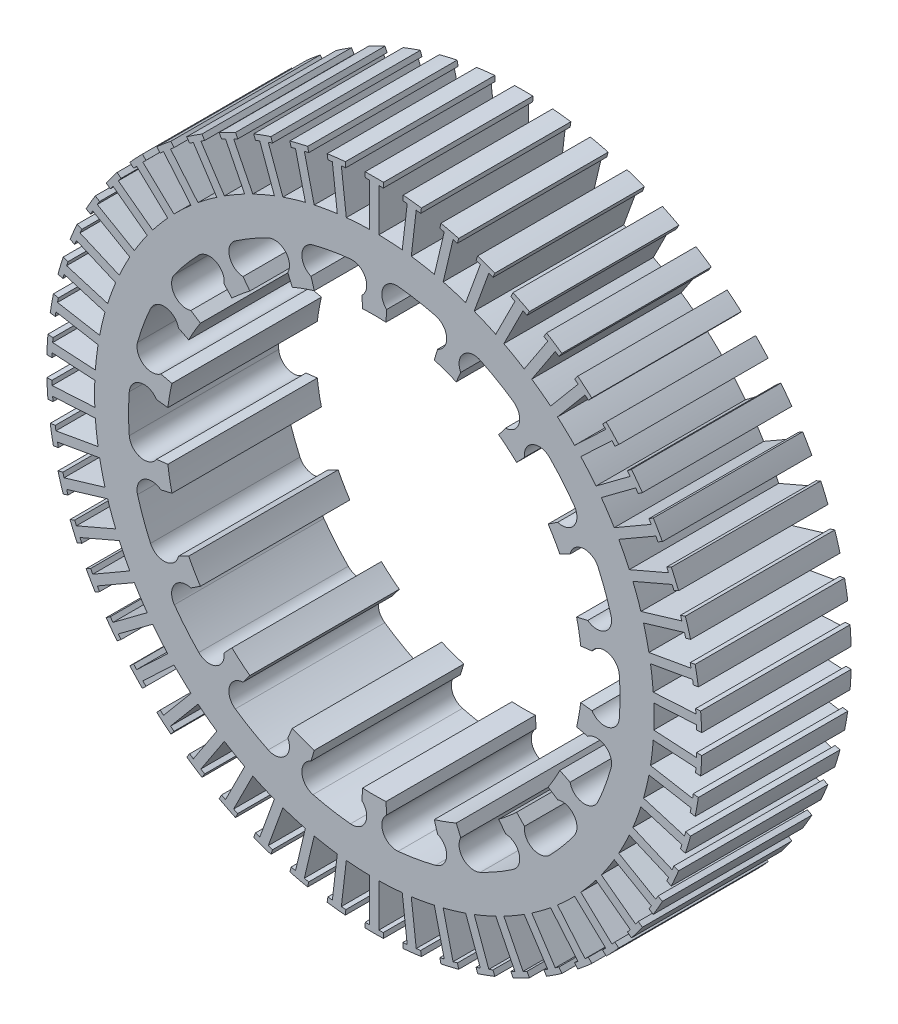
from build123d import *

# Parameters (mm, degrees)
SKETCH1_R           = 36.966779
BOSS_EXTRUDE1_DEPTH = 19.750024
SKETCH2_R           = 32.478218
BOSS_EXTRUDE2_DEPTH = 19.750024


with BuildPart() as part:
    # Sketch1 → Boss-Extrude1 (new body)
    with BuildSketch(Plane.XY):
        Circle(SKETCH1_R)
        with BuildLine():
            Line((1.546352, -27.427050505), (1.631124552, -28.930628639))
            ThreePointArc((1.631124552, -28.930628639), (1.168844503, -31.173997989), (3.149035062, -32.325194858))
            ThreePointArc((3.149035062, -32.325194858), (4.397703875, -32.179105722), (5.63978337, -31.98480089))
            ThreePointArc((5.63978337, -31.98480089), (6.873412472, -31.7425715), (8.096742768, -31.452780497))
            ThreePointArc((8.096742768, -31.452780497), (9.563780706, -29.693744235), (8.362102049, -27.7437757))
            Line((8.362102049, -27.7437757), (7.927508181, -26.301880502))
            ThreePointArc((7.927508181, -26.301880502), (9.395501285, -25.813927626), (10.833699308, -25.244113436))
            Line((10.833699308, -25.244113436), (11.427613459, -26.628020794))
            ThreePointArc((11.427613459, -26.628020794), (11.760489815, -28.894207506), (14.014992789, -29.29871365))
            ThreePointArc((14.014992789, -29.29871365), (15.138392231, -28.734364881), (16.239109, -28.126961858))
            ThreePointArc((16.239109, -28.126961858), (17.315493833, -27.477414685), (18.365933925, -26.786696615))
            ThreePointArc((18.365933925, -26.786696615), (19.142872815, -24.631986694), (17.346735731, -23.210613957))
            Line((17.346735731, -23.210613957), (16.445193878, -22.004315536))
            ThreePointArc((16.445193878, -22.004315536), (17.657766453, -21.043706607), (18.814342591, -20.016363724))
            Line((18.814342591, -20.016363724), (19.845763529, -21.113680654))
            ThreePointArc((19.845763529, -21.113680654), (20.933646488, -23.129349165), (23.190535546, -22.738375173))
            ThreePointArc((23.190535546, -22.738375173), (24.053167065, -21.823835561), (24.879758421, -20.876596115))
            ThreePointArc((24.879758421, -20.876596115), (25.669071089, -19.898076135), (26.419922398, -18.889741791))
            ThreePointArc((26.419922398, -18.889741791), (26.413051944, -16.599248028), (24.239097073, -15.877909618))
            Line((24.239097073, -15.877909618), (22.979346488, -15.052705367))
            ThreePointArc((22.979346488, -15.052705367), (23.790244385, -13.735304), (24.525698488, -12.374345137))
            Line((24.525698488, -12.374345137), (25.870221625, -13.052719021))
            ThreePointArc((25.870221625, -13.052719021), (27.581896448, -14.574749961), (29.568957461, -13.435453068))
            ThreePointArc((29.568957461, -13.435453068), (30.066774964, -12.281029587), (30.519541791, -11.108204775))
            ThreePointArc((30.519541791, -11.108204775), (30.926579536, -9.918735939), (31.287278314, -8.714405324))
            ThreePointArc((31.287278314, -8.714405324), (30.497427194, -6.56439507), (28.207865578, -6.630095047))
            Line((28.207865578, -6.630095047), (26.741850772, -6.285516777))
            ThreePointArc((26.741850772, -6.285516777), (27.053267738, -4.770221019), (27.278893186, -3.2397979))
            Line((27.278893186, -3.2397979), (28.77434919, -3.417406837))
            ThreePointArc((28.77434919, -3.417406837), (30.90336263, -4.262220812), (32.380926714, -2.512017036))
            ThreePointArc((32.380926714, -2.512017036), (32.453886064, -1.256950196), (32.478218, 0))
            ThreePointArc((32.478218, 0), (32.453886064, 1.256950196), (32.380926714, 2.512017036))
            ThreePointArc((32.380926714, 2.512017036), (30.90336263, 4.262220812), (28.77434919, 3.417406837))
            Line((28.77434919, 3.417406837), (27.278893186, 3.2397979))
            ThreePointArc((27.278893186, 3.2397979), (27.053267738, 4.770221019), (26.741850772, 6.285516777))
            Line((26.741850772, 6.285516777), (28.207865578, 6.630095047))
            ThreePointArc((28.207865578, 6.630095047), (30.497427194, 6.56439507), (31.287278314, 8.714405324))
            ThreePointArc((31.287278314, 8.714405324), (30.926579536, 9.918735939), (30.519541791, 11.108204775))
            ThreePointArc((30.519541791, 11.108204775), (30.066774964, 12.281029587), (29.568957461, 13.435453068))
            ThreePointArc((29.568957461, 13.435453068), (27.581896448, 14.574749961), (25.870221625, 13.052719021))
            Line((25.870221625, 13.052719021), (24.525698488, 12.374345137))
            ThreePointArc((24.525698488, 12.374345137), (23.790244385, 13.735304), (22.979346488, 15.052705367))
            Line((22.979346488, 15.052705367), (24.239097073, 15.877909618))
            ThreePointArc((24.239097073, 15.877909618), (26.413051944, 16.599248028), (26.419922398, 18.889741791))
            ThreePointArc((26.419922398, 18.889741791), (25.669071089, 19.898076135), (24.879758421, 20.876596115))
            ThreePointArc((24.879758421, 20.876596115), (24.053167065, 21.823835561), (23.190535546, 22.738375173))
            ThreePointArc((23.190535546, 22.738375173), (20.933646488, 23.129349165), (19.845763529, 21.113680654))
            Line((19.845763529, 21.113680654), (18.814342591, 20.016363724))
            ThreePointArc((18.814342591, 20.016363724), (17.657766453, 21.043706607), (16.445193878, 22.004315536))
            Line((16.445193878, 22.004315536), (17.346735731, 23.210613957))
            ThreePointArc((17.346735731, 23.210613957), (19.142872815, 24.631986694), (18.365933925, 26.786696615))
            ThreePointArc((18.365933925, 26.786696615), (17.315493833, 27.477414685), (16.239109, 28.126961858))
            ThreePointArc((16.239109, 28.126961858), (15.138392231, 28.734364881), (14.014992789, 29.29871365))
            ThreePointArc((14.014992789, 29.29871365), (11.760489815, 28.894207506), (11.427613459, 26.628020794))
            Line((11.427613459, 26.628020794), (10.833699308, 25.244113436))
            ThreePointArc((10.833699308, 25.244113436), (9.395501285, 25.813927626), (7.927508181, 26.301880502))
            Line((7.927508181, 26.301880502), (8.362102049, 27.7437757))
            ThreePointArc((8.362102049, 27.7437757), (9.563780706, 29.693744235), (8.096742768, 31.452780497))
            ThreePointArc((8.096742768, 31.452780497), (6.873412472, 31.7425715), (5.63978337, 31.98480089))
            ThreePointArc((5.63978337, 31.98480089), (4.397703875, 32.179105722), (3.149035062, 32.325194858))
            ThreePointArc((3.149035062, 32.325194858), (1.168844503, 31.173997989), (1.631124552, 28.930628639))
            Line((1.631124552, 28.930628639), (1.546352, 27.427050505))
            ThreePointArc((1.546352, 27.427050505), (0, 27.470608), (-1.546352, 27.427050505))
            Line((-1.546352, 27.427050505), (-1.631124552, 28.930628639))
            ThreePointArc((-1.631124552, 28.930628639), (-1.168844503, 31.173997989), (-3.149035062, 32.325194858))
            ThreePointArc((-3.149035062, 32.325194858), (-4.397703875, 32.179105722), (-5.63978337, 31.98480089))
            ThreePointArc((-5.63978337, 31.98480089), (-6.873412472, 31.7425715), (-8.096742768, 31.452780497))
            ThreePointArc((-8.096742768, 31.452780497), (-9.563780706, 29.693744235), (-8.362102049, 27.7437757))
            Line((-8.362102049, 27.7437757), (-7.927508181, 26.301880502))
            ThreePointArc((-7.927508181, 26.301880502), (-9.395501285, 25.813927626), (-10.833699308, 25.244113436))
            Line((-10.833699308, 25.244113436), (-11.427613459, 26.628020794))
            ThreePointArc((-11.427613459, 26.628020794), (-11.760489815, 28.894207506), (-14.014992789, 29.29871365))
            ThreePointArc((-14.014992789, 29.29871365), (-15.138392231, 28.734364881), (-16.239109, 28.126961858))
            ThreePointArc((-16.239109, 28.126961858), (-17.315493833, 27.477414685), (-18.365933925, 26.786696615))
            ThreePointArc((-18.365933925, 26.786696615), (-19.142872815, 24.631986694), (-17.346735731, 23.210613957))
            Line((-17.346735731, 23.210613957), (-16.445193878, 22.004315536))
            ThreePointArc((-16.445193878, 22.004315536), (-17.657766453, 21.043706607), (-18.814342591, 20.016363724))
            Line((-18.814342591, 20.016363724), (-19.845763529, 21.113680654))
            ThreePointArc((-19.845763529, 21.113680654), (-20.933646488, 23.129349165), (-23.190535546, 22.738375173))
            ThreePointArc((-23.190535546, 22.738375173), (-24.053167065, 21.823835561), (-24.879758421, 20.876596115))
            ThreePointArc((-24.879758421, 20.876596115), (-25.669071089, 19.898076135), (-26.419922398, 18.889741791))
            ThreePointArc((-26.419922398, 18.889741791), (-26.413051944, 16.599248028), (-24.239097073, 15.877909618))
            Line((-24.239097073, 15.877909618), (-22.979346488, 15.052705367))
            ThreePointArc((-22.979346488, 15.052705367), (-23.790244385, 13.735304), (-24.525698488, 12.374345137))
            Line((-24.525698488, 12.374345137), (-25.870221625, 13.052719021))
            ThreePointArc((-25.870221625, 13.052719021), (-27.581896448, 14.574749961), (-29.568957461, 13.435453068))
            ThreePointArc((-29.568957461, 13.435453068), (-30.066774964, 12.281029587), (-30.519541791, 11.108204775))
            ThreePointArc((-30.519541791, 11.108204775), (-30.926579536, 9.918735939), (-31.287278314, 8.714405324))
            ThreePointArc((-31.287278314, 8.714405324), (-30.497427194, 6.56439507), (-28.207865578, 6.630095047))
            Line((-28.207865578, 6.630095047), (-26.741850772, 6.285516777))
            ThreePointArc((-26.741850772, 6.285516777), (-27.053267738, 4.770221019), (-27.278893186, 3.2397979))
            Line((-27.278893186, 3.2397979), (-28.77434919, 3.417406837))
            ThreePointArc((-28.77434919, 3.417406837), (-30.90336263, 4.262220812), (-32.380926714, 2.512017036))
            ThreePointArc((-32.380926714, 2.512017036), (-32.453886064, 1.256950196), (-32.478218, 0))
            ThreePointArc((-32.478218, 0), (-32.453886064, -1.256950196), (-32.380926714, -2.512017036))
            ThreePointArc((-32.380926714, -2.512017036), (-30.90336263, -4.262220812), (-28.77434919, -3.417406837))
            Line((-28.77434919, -3.417406837), (-27.278893186, -3.2397979))
            ThreePointArc((-27.278893186, -3.2397979), (-27.053267738, -4.770221019), (-26.741850772, -6.285516777))
            Line((-26.741850772, -6.285516777), (-28.207865578, -6.630095047))
            ThreePointArc((-28.207865578, -6.630095047), (-30.497427194, -6.56439507), (-31.287278314, -8.714405324))
            ThreePointArc((-31.287278314, -8.714405324), (-30.926579536, -9.918735939), (-30.519541791, -11.108204775))
            ThreePointArc((-30.519541791, -11.108204775), (-30.066774964, -12.281029587), (-29.568957461, -13.435453068))
            ThreePointArc((-29.568957461, -13.435453068), (-27.581896448, -14.574749961), (-25.870221625, -13.052719021))
            Line((-25.870221625, -13.052719021), (-24.525698488, -12.374345137))
            ThreePointArc((-24.525698488, -12.374345137), (-23.790244385, -13.735304), (-22.979346488, -15.052705367))
            Line((-22.979346488, -15.052705367), (-24.239097073, -15.877909618))
            ThreePointArc((-24.239097073, -15.877909618), (-26.413051944, -16.599248028), (-26.419922398, -18.889741791))
            ThreePointArc((-26.419922398, -18.889741791), (-25.669071089, -19.898076135), (-24.879758421, -20.876596115))
            ThreePointArc((-24.879758421, -20.876596115), (-24.053167065, -21.823835561), (-23.190535546, -22.738375173))
            ThreePointArc((-23.190535546, -22.738375173), (-20.933646488, -23.129349165), (-19.845763529, -21.113680654))
            Line((-19.845763529, -21.113680654), (-18.814342591, -20.016363724))
            ThreePointArc((-18.814342591, -20.016363724), (-17.657766453, -21.043706607), (-16.445193878, -22.004315536))
            Line((-16.445193878, -22.004315536), (-17.346735731, -23.210613957))
            ThreePointArc((-17.346735731, -23.210613957), (-19.142872815, -24.631986694), (-18.365933925, -26.786696615))
            ThreePointArc((-18.365933925, -26.786696615), (-17.315493833, -27.477414685), (-16.239109, -28.126961858))
            ThreePointArc((-16.239109, -28.126961858), (-15.138392231, -28.734364881), (-14.014992789, -29.29871365))
            ThreePointArc((-14.014992789, -29.29871365), (-11.760489815, -28.894207506), (-11.427613459, -26.628020794))
            Line((-11.427613459, -26.628020794), (-10.833699308, -25.244113436))
            ThreePointArc((-10.833699308, -25.244113436), (-9.395501285, -25.813927626), (-7.927508181, -26.301880502))
            Line((-7.927508181, -26.301880502), (-8.362102049, -27.7437757))
            ThreePointArc((-8.362102049, -27.7437757), (-9.563780706, -29.693744235), (-8.096742768, -31.452780497))
            ThreePointArc((-8.096742768, -31.452780497), (-6.873412472, -31.7425715), (-5.63978337, -31.98480089))
            ThreePointArc((-5.63978337, -31.98480089), (-4.397703875, -32.179105722), (-3.149035062, -32.325194858))
            ThreePointArc((-3.149035062, -32.325194858), (-1.168844503, -31.173997989), (-1.631124552, -28.930628639))
            Line((-1.631124552, -28.930628639), (-1.546352, -27.427050505))
            ThreePointArc((-1.546352, -27.427050505), (0, -27.470608), (1.546352, -27.427050505))
        make_face(mode=Mode.SUBTRACT)
    extrude(amount=-BOSS_EXTRUDE1_DEPTH)

    # Sketch2 → Boss-Extrude2 (add)
    with BuildSketch(Plane.XY):
        with BuildLine():
            Line((0.599948, -36.961910287), (0.599948, -42.615834159))
            ThreePointArc((0.599948, -42.615834159), (0.89532901, -42.610651774), (1.190667002, -42.603422055))
            Line((1.190667002, -42.603422055), (1.209378998, -43.272958627))
            ThreePointArc((1.209378998, -43.272958627), (0, -43.289855), (-1.209378998, -43.272958627))
            Line((-1.209378998, -43.272958627), (-1.190667002, -42.603422055))
            ThreePointArc((-1.190667002, -42.603422055), (-0.89532901, -42.610651774), (-0.599948, -42.615834159))
            Line((-0.599948, -42.615834159), (-0.599948, -36.961910287))
            ThreePointArc((-0.599948, -36.961910287), (-2.14942704, -36.904237061), (-3.695124511, -36.781636784))
            Line((-3.695124511, -36.781636784), (-4.351505009, -42.397330846))
            ThreePointArc((-4.351505009, -42.397330846), (-4.057519622, -42.426475145), (-3.763339281, -42.453580958))
            Line((-3.763339281, -42.453580958), (-3.82248226, -43.120762694))
            ThreePointArc((-3.82248226, -43.120762694), (-5.025645419, -42.997144487), (-6.22488548, -42.839962029))
            Line((-6.22488548, -42.839962029), (-6.128571555, -42.177124954))
            ThreePointArc((-6.128571555, -42.177124954), (-5.836069853, -42.218592437), (-5.543287742, -42.258031422))
            Line((-5.543287742, -42.258031422), (-4.886907243, -36.64233736))
            ThreePointArc((-4.886907243, -36.64233736), (-6.419213808, -36.405170563), (-7.940226801, -36.103954742))
            Line((-7.940226801, -36.103954742), (-9.244111378, -41.605476364))
            ThreePointArc((-9.244111378, -41.605476364), (-8.955497261, -41.66855322), (-8.666452855, -41.729628007))
            Line((-8.666452855, -41.729628007), (-8.802651002, -42.385432418))
            ThreePointArc((-8.802651002, -42.385432418), (-9.983327605, -42.122971356), (-11.156211064, -41.827628436))
            Line((-11.156211064, -41.827628436), (-10.983597692, -41.180454592))
            ThreePointArc((-10.983597692, -41.180454592), (-10.697887862, -41.255599062), (-10.411664026, -41.328761304))
            Line((-10.411664026, -41.328761304), (-9.107779449, -35.827239681))
            ThreePointArc((-9.107779449, -35.827239681), (-10.60219172, -35.413786586), (-12.077951145, -34.938028647))
            Line((-12.077951145, -34.938028647), (-14.011706999, -40.250979189))
            ThreePointArc((-14.011706999, -40.250979189), (-13.732367163, -40.347135596), (-13.452367522, -40.441353424))
            Line((-13.452367522, -40.441353424), (-13.663778991, -41.07691188))
            ThreePointArc((-13.663778991, -41.07691188), (-14.806002412, -40.679157298), (-15.936668032, -40.249647923))
            Line((-15.936668032, -40.249647923), (-15.690089512, -39.626889227))
            ThreePointArc((-15.690089512, -39.626889227), (-15.415035291, -39.734694483), (-15.139240416, -39.840590587))
            Line((-15.139240416, -39.840590587), (-13.205484562, -34.527640045))
            ThreePointArc((-13.205484562, -34.527640045), (-14.641793178, -33.943491897), (-16.05234192, -33.299625651))
            Line((-16.05234192, -33.299625651), (-18.589818319, -38.35215657))
            ThreePointArc((-18.589818319, -38.35215657), (-18.323530357, -38.480092177), (-18.056361996, -38.606178912))
            Line((-18.056361996, -38.606178912), (-18.340127809, -39.212896576))
            ThreePointArc((-18.340127809, -39.212896576), (-19.428451435, -38.685227423), (-20.501608904, -38.12735997))
            Line((-20.501608904, -38.12735997), (-20.184399788, -37.537438163))
            ThreePointArc((-20.184399788, -37.537438163), (-19.923720811, -37.676446325), (-19.662084549, -37.813644229))
            Line((-19.662084549, -37.813644229), (-17.124608151, -32.76111331))
            ThreePointArc((-17.124608151, -32.76111331), (-18.4833895, -32.01416971), (-19.809652308, -31.210902343))
            Line((-19.809652308, -31.210902343), (-22.916534237, -35.934686826))
            ThreePointArc((-22.916534237, -35.934686826), (-22.666899237, -36.092671523), (-22.416175148, -36.248922058))
            Line((-22.416175148, -36.248922058), (-22.768457861, -36.818594114))
            ThreePointArc((-22.768457861, -36.818594114), (-23.788163982, -36.16814621), (-24.789300686, -35.489464879))
            Line((-24.789300686, -35.489464879), (-24.405750683, -34.940357644))
            ThreePointArc((-24.405750683, -34.940357644), (-24.162972187, -35.108688865), (-23.91903272, -35.275333201))
            Line((-23.91903272, -35.275333201), (-20.812150791, -30.551548719))
            ThreePointArc((-20.812150791, -30.551548719), (-22.075029687, -29.651910797), (-23.299071131, -28.700105123))
            Line((-23.299071131, -28.700105123), (-26.933343342, -33.031262087))
            ThreePointArc((-26.933343342, -33.031262087), (-26.703737188, -33.217159404), (-26.472847987, -33.401460719))
            Line((-26.472847987, -33.401460719), (-26.888883579, -33.926383329))
            ThreePointArc((-26.888883579, -33.926383329), (-27.826182419, -33.161952866), (-28.741759702, -32.371635658))
            Line((-28.741759702, -32.371635658), (-28.297055667, -31.870768727))
            ThreePointArc((-28.297055667, -31.870768727), (-28.075460814, -32.066146615), (-27.852517006, -32.259983806))
            Line((-27.852517006, -32.259983806), (-24.218244794, -27.928826841))
            ThreePointArc((-24.218244794, -27.928826841), (-25.368142968, -26.888660658), (-26.473409986, -25.801188215))
            Line((-26.473409986, -25.801188215), (-30.585925183, -29.681146194))
            ThreePointArc((-30.585925183, -29.681146194), (-30.379452905, -29.892442187), (-30.17152097, -30.102301922))
            Line((-30.17152097, -30.102301922), (-30.645683274, -30.57537641))
            ThreePointArc((-30.645683274, -30.57537641), (-31.487899475, -29.707300998), (-32.305535723, -28.816035598))
            Line((-32.305535723, -28.816035598), (-31.805691517, -28.370182337))
            ThreePointArc((-31.805691517, -28.370182337), (-31.608276997, -28.589964742), (-31.409343779, -28.808373471))
            Line((-31.409343779, -28.808373471), (-27.296828583, -24.928415492))
            ThreePointArc((-27.296828583, -24.928415492), (-28.318195633, -23.761787511), (-29.289741387, -22.553354499))
            Line((-29.289741387, -22.553354499), (-33.824884855, -25.929643716))
            ThreePointArc((-33.824884855, -25.929643716), (-33.644338636, -26.163480969), (-33.462175891, -26.396061133))
            Line((-33.462175891, -26.396061133), (-33.988052675, -26.810889976))
            ThreePointArc((-33.988052675, -26.810889976), (-34.723796707, -25.850908847), (-35.432434794, -24.870748089))
            Line((-35.432434794, -24.870748089), (-34.884209951, -24.485937899))
            ThreePointArc((-34.884209951, -24.485937899), (-34.713645457, -24.727152641), (-34.54141306, -24.967179305))
            Line((-34.54141306, -24.967179305), (-30.006269592, -21.590890088))
            ThreePointArc((-30.006269592, -21.590890088), (-30.885293282, -20.313576951), (-31.709979281, -19.000525352))
            Line((-31.709979281, -19.000525352), (-36.606420985, -21.827487289))
            ThreePointArc((-36.606420985, -21.827487289), (-36.454242404, -22.080703555), (-36.300312287, -22.332858898))
            Line((-36.300312287, -22.332858898), (-36.870791969, -22.683832249))
            ThreePointArc((-36.870791969, -22.683832249), (-37.490114156, -21.6449275), (-38.080170967, -20.589126378))
            Line((-38.080170967, -20.589126378), (-37.490979288, -20.270563157))
            ThreePointArc((-37.490979288, -20.270563157), (-37.349571413, -20.52994822), (-37.206368985, -20.788346871))
            Line((-37.206368985, -20.788346871), (-32.309927281, -17.961384934))
            ThreePointArc((-32.309927281, -17.961384934), (-33.034720322, -16.59066011), (-33.701394103, -15.190746696))
            Line((-33.701394103, -15.190746696), (-38.89291807, -17.43015154))
            ThreePointArc((-38.89291807, -17.43015154), (-38.771165079, -17.699322503), (-38.647549231, -17.967643059))
            Line((-38.647549231, -17.967643059), (-39.254917053, -18.250014605))
            ThreePointArc((-39.254917053, -18.250014605), (-39.749442126, -17.14623564), (-40.212938155, -16.029072053))
            Line((-40.212938155, -16.029072053), (-39.590747446, -15.781063821))
            ThreePointArc((-39.590747446, -15.781063821), (-39.480408489, -16.055111468), (-39.368172597, -16.328387706))
            Line((-39.368172597, -16.328387706), (-34.17664863, -14.088982862))
            ThreePointArc((-34.17664863, -14.088982862), (-34.737409441, -12.643383052), (-35.237055384, -11.175539249))
            Line((-35.237055384, -11.175539249), (-40.653455157, -12.797102893))
            ThreePointArc((-40.653455157, -12.797102893), (-40.563774259, -13.078588478), (-40.472144372, -13.35944567))
            Line((-40.472144372, -13.35944567), (-41.108186725, -13.56939682))
            ThreePointArc((-41.108186725, -13.56939682), (-41.47122708, -12.415670358), (-41.801894338, -11.252252026))
            Line((-41.801894338, -11.252252026), (-41.155118662, -11.07815267))
            ThreePointArc((-41.155118662, -11.07815267), (-41.077340767, -11.363156875), (-40.997589209, -11.64761511))
            Line((-40.997589209, -11.64761511), (-35.581189436, -10.026051465))
            ThreePointArc((-35.581189436, -10.026051465), (-35.970334688, -8.525125928), (-36.296195939, -7.009201806))
            Line((-36.296195939, -7.009201806), (-41.864224004, -7.990995383))
            ThreePointArc((-41.864224004, -7.990995383), (-41.807827977, -8.28098898), (-41.749423189, -8.570584697))
            Line((-41.749423189, -8.570584697), (-42.405538693, -8.705276222))
            ThreePointArc((-42.405538693, -8.705276222), (-42.632184831, -7.517204432), (-42.825551611, -6.323264594))
            Line((-42.825551611, -6.323264594), (-42.162937499, -6.225428508))
            ThreePointArc((-42.162937499, -6.225428508), (-42.118772479, -6.517535079), (-42.072583758, -6.8093285))
            Line((-42.072583758, -6.8093285), (-36.504555693, -5.827534923))
            ThreePointArc((-36.504555693, -5.827534923), (-36.716822865, -4.2915811), (-36.864492711, -2.748076933))
            Line((-36.864492711, -2.748076933), (-42.508851039, -3.076823369))
            ThreePointArc((-42.508851039, -3.076823369), (-42.486502544, -3.371403312), (-42.462112678, -3.665821268))
            Line((-42.462112678, -3.665821268), (-43.129428495, -3.723431696))
            ThreePointArc((-43.129428495, -3.723431696), (-43.216615417, -2.517081213), (-43.270066765, -1.308765855))
            Line((-43.270066765, -1.308765855), (-42.600574937, -1.288516105))
            ThreePointArc((-42.600574937, -1.288516105), (-42.590620048, -1.583774802), (-42.578618786, -1.878957403))
            Line((-42.578618786, -1.878957403), (-36.934260458, -1.550210967))
            ThreePointArc((-36.934260458, -1.550210967), (-36.966779, 0), (-36.934260458, 1.550210967))
            Line((-36.934260458, 1.550210967), (-42.578618786, 1.878957403))
            ThreePointArc((-42.578618786, 1.878957403), (-42.590620048, 1.583774802), (-42.600574937, 1.288516105))
            Line((-42.600574937, 1.288516105), (-43.270066765, 1.308765855))
            ThreePointArc((-43.270066765, 1.308765855), (-43.216615417, 2.517081213), (-43.129428495, 3.723431696))
            Line((-43.129428495, 3.723431696), (-42.462112678, 3.665821268))
            ThreePointArc((-42.462112678, 3.665821268), (-42.486502544, 3.371403312), (-42.508851039, 3.076823369))
            Line((-42.508851039, 3.076823369), (-36.864492711, 2.748076933))
            ThreePointArc((-36.864492711, 2.748076933), (-36.716822865, 4.2915811), (-36.504555693, 5.827534923))
            Line((-36.504555693, 5.827534923), (-42.072583758, 6.8093285))
            ThreePointArc((-42.072583758, 6.8093285), (-42.118772479, 6.517535079), (-42.162937499, 6.225428508))
            Line((-42.162937499, 6.225428508), (-42.825551611, 6.323264594))
            ThreePointArc((-42.825551611, 6.323264594), (-42.632184831, 7.517204432), (-42.405538693, 8.705276222))
            Line((-42.405538693, 8.705276222), (-41.749423189, 8.570584697))
            ThreePointArc((-41.749423189, 8.570584697), (-41.807827977, 8.28098898), (-41.864224004, 7.990995383))
            Line((-41.864224004, 7.990995383), (-36.296195939, 7.009201806))
            ThreePointArc((-36.296195939, 7.009201806), (-35.970334688, 8.525125928), (-35.581189436, 10.026051465))
            Line((-35.581189436, 10.026051465), (-40.997589209, 11.64761511))
            ThreePointArc((-40.997589209, 11.64761511), (-41.077340767, 11.363156875), (-41.155118662, 11.07815267))
            Line((-41.155118662, 11.07815267), (-41.801894338, 11.252252026))
            ThreePointArc((-41.801894338, 11.252252026), (-41.47122708, 12.415670358), (-41.108186725, 13.56939682))
            Line((-41.108186725, 13.56939682), (-40.472144372, 13.35944567))
            ThreePointArc((-40.472144372, 13.35944567), (-40.563774259, 13.078588478), (-40.653455157, 12.797102893))
            Line((-40.653455157, 12.797102893), (-35.237055384, 11.175539249))
            ThreePointArc((-35.237055384, 11.175539249), (-34.737409441, 12.643383052), (-34.17664863, 14.088982862))
            Line((-34.17664863, 14.088982862), (-39.368172597, 16.328387706))
            ThreePointArc((-39.368172597, 16.328387706), (-39.480408489, 16.055111468), (-39.590747446, 15.781063821))
            Line((-39.590747446, 15.781063821), (-40.212938155, 16.029072053))
            ThreePointArc((-40.212938155, 16.029072053), (-39.749442126, 17.14623564), (-39.254917053, 18.250014605))
            Line((-39.254917053, 18.250014605), (-38.647549231, 17.967643059))
            ThreePointArc((-38.647549231, 17.967643059), (-38.771165079, 17.699322503), (-38.89291807, 17.43015154))
            Line((-38.89291807, 17.43015154), (-33.701394103, 15.190746696))
            ThreePointArc((-33.701394103, 15.190746696), (-33.034720322, 16.59066011), (-32.309927281, 17.961384934))
            Line((-32.309927281, 17.961384934), (-37.206368985, 20.788346871))
            ThreePointArc((-37.206368985, 20.788346871), (-37.349571413, 20.52994822), (-37.490979288, 20.270563157))
            Line((-37.490979288, 20.270563157), (-38.080170967, 20.589126378))
            ThreePointArc((-38.080170967, 20.589126378), (-37.490114156, 21.6449275), (-36.870791969, 22.683832249))
            Line((-36.870791969, 22.683832249), (-36.300312287, 22.332858898))
            ThreePointArc((-36.300312287, 22.332858898), (-36.454242404, 22.080703555), (-36.606420985, 21.827487289))
            Line((-36.606420985, 21.827487289), (-31.709979281, 19.000525352))
            ThreePointArc((-31.709979281, 19.000525352), (-30.885293282, 20.313576951), (-30.006269592, 21.590890088))
            Line((-30.006269592, 21.590890088), (-34.54141306, 24.967179305))
            ThreePointArc((-34.54141306, 24.967179305), (-34.713645457, 24.727152641), (-34.884209951, 24.485937899))
            Line((-34.884209951, 24.485937899), (-35.432434794, 24.870748089))
            ThreePointArc((-35.432434794, 24.870748089), (-34.723796707, 25.850908847), (-33.988052675, 26.810889976))
            Line((-33.988052675, 26.810889976), (-33.462175891, 26.396061133))
            ThreePointArc((-33.462175891, 26.396061133), (-33.644338636, 26.163480969), (-33.824884855, 25.929643716))
            Line((-33.824884855, 25.929643716), (-29.289741387, 22.553354499))
            ThreePointArc((-29.289741387, 22.553354499), (-28.318195633, 23.761787511), (-27.296828583, 24.928415492))
            Line((-27.296828583, 24.928415492), (-31.409343779, 28.808373471))
            ThreePointArc((-31.409343779, 28.808373471), (-31.608276997, 28.589964742), (-31.805691517, 28.370182337))
            Line((-31.805691517, 28.370182337), (-32.305535723, 28.816035598))
            ThreePointArc((-32.305535723, 28.816035598), (-31.487899475, 29.707300998), (-30.645683274, 30.57537641))
            Line((-30.645683274, 30.57537641), (-30.17152097, 30.102301922))
            ThreePointArc((-30.17152097, 30.102301922), (-30.379452905, 29.892442187), (-30.585925183, 29.681146194))
            Line((-30.585925183, 29.681146194), (-26.473409986, 25.801188215))
            ThreePointArc((-26.473409986, 25.801188215), (-25.368142968, 26.888660658), (-24.218244794, 27.928826841))
            Line((-24.218244794, 27.928826841), (-27.852517006, 32.259983806))
            ThreePointArc((-27.852517006, 32.259983806), (-28.075460814, 32.066146615), (-28.297055667, 31.870768727))
            Line((-28.297055667, 31.870768727), (-28.741759702, 32.371635658))
            ThreePointArc((-28.741759702, 32.371635658), (-27.826182419, 33.161952866), (-26.888883579, 33.926383329))
            Line((-26.888883579, 33.926383329), (-26.472847987, 33.401460719))
            ThreePointArc((-26.472847987, 33.401460719), (-26.703737188, 33.217159404), (-26.933343342, 33.031262087))
            Line((-26.933343342, 33.031262087), (-23.299071131, 28.700105123))
            ThreePointArc((-23.299071131, 28.700105123), (-22.075029687, 29.651910797), (-20.812150791, 30.551548719))
            Line((-20.812150791, 30.551548719), (-23.91903272, 35.275333201))
            ThreePointArc((-23.91903272, 35.275333201), (-24.162972187, 35.108688865), (-24.405750683, 34.940357644))
            Line((-24.405750683, 34.940357644), (-24.789300686, 35.489464879))
            ThreePointArc((-24.789300686, 35.489464879), (-23.788163982, 36.16814621), (-22.768457861, 36.818594114))
            Line((-22.768457861, 36.818594114), (-22.416175148, 36.248922058))
            ThreePointArc((-22.416175148, 36.248922058), (-22.666899237, 36.092671523), (-22.916534237, 35.934686826))
            Line((-22.916534237, 35.934686826), (-19.809652308, 31.210902343))
            ThreePointArc((-19.809652308, 31.210902343), (-18.4833895, 32.01416971), (-17.124608151, 32.76111331))
            Line((-17.124608151, 32.76111331), (-19.662084549, 37.813644229))
            ThreePointArc((-19.662084549, 37.813644229), (-19.923720811, 37.676446325), (-20.184399788, 37.537438163))
            Line((-20.184399788, 37.537438163), (-20.501608904, 38.12735997))
            ThreePointArc((-20.501608904, 38.12735997), (-19.428451435, 38.685227423), (-18.340127809, 39.212896576))
            Line((-18.340127809, 39.212896576), (-18.056361996, 38.606178912))
            ThreePointArc((-18.056361996, 38.606178912), (-18.323530357, 38.480092177), (-18.589818319, 38.35215657))
            Line((-18.589818319, 38.35215657), (-16.05234192, 33.299625651))
            ThreePointArc((-16.05234192, 33.299625651), (-14.641793178, 33.943491897), (-13.205484562, 34.527640045))
            Line((-13.205484562, 34.527640045), (-15.139240416, 39.840590587))
            ThreePointArc((-15.139240416, 39.840590587), (-15.415035291, 39.734694483), (-15.690089512, 39.626889227))
            Line((-15.690089512, 39.626889227), (-15.936668032, 40.249647923))
            ThreePointArc((-15.936668032, 40.249647923), (-14.806002412, 40.679157298), (-13.663778991, 41.07691188))
            Line((-13.663778991, 41.07691188), (-13.452367522, 40.441353424))
            ThreePointArc((-13.452367522, 40.441353424), (-13.732367163, 40.347135596), (-14.011706999, 40.250979189))
            Line((-14.011706999, 40.250979189), (-12.077951145, 34.938028647))
            ThreePointArc((-12.077951145, 34.938028647), (-10.60219172, 35.413786586), (-9.107779449, 35.827239681))
            Line((-9.107779449, 35.827239681), (-10.411664026, 41.328761304))
            ThreePointArc((-10.411664026, 41.328761304), (-10.697887862, 41.255599062), (-10.983597692, 41.180454592))
            Line((-10.983597692, 41.180454592), (-11.156211064, 41.827628436))
            ThreePointArc((-11.156211064, 41.827628436), (-9.983327605, 42.122971356), (-8.802651002, 42.385432418))
            Line((-8.802651002, 42.385432418), (-8.666452855, 41.729628007))
            ThreePointArc((-8.666452855, 41.729628007), (-8.955497261, 41.66855322), (-9.244111378, 41.605476364))
            Line((-9.244111378, 41.605476364), (-7.940226801, 36.103954742))
            ThreePointArc((-7.940226801, 36.103954742), (-6.419213808, 36.405170563), (-4.886907243, 36.64233736))
            Line((-4.886907243, 36.64233736), (-5.543287742, 42.258031422))
            ThreePointArc((-5.543287742, 42.258031422), (-5.836069853, 42.218592437), (-6.128571555, 42.177124954))
            Line((-6.128571555, 42.177124954), (-6.22488548, 42.839962029))
            ThreePointArc((-6.22488548, 42.839962029), (-5.025645419, 42.997144487), (-3.82248226, 43.120762694))
            Line((-3.82248226, 43.120762694), (-3.763339281, 42.453580958))
            ThreePointArc((-3.763339281, 42.453580958), (-4.057519622, 42.426475145), (-4.351505009, 42.397330846))
            Line((-4.351505009, 42.397330846), (-3.695124511, 36.781636784))
            ThreePointArc((-3.695124511, 36.781636784), (-2.14942704, 36.904237061), (-0.599948, 36.961910287))
            Line((-0.599948, 36.961910287), (-0.599948, 42.615834159))
            ThreePointArc((-0.599948, 42.615834159), (-0.89532901, 42.610651774), (-1.190667002, 42.603422055))
            Line((-1.190667002, 42.603422055), (-1.209378998, 43.272958627))
            ThreePointArc((-1.209378998, 43.272958627), (0, 43.289855), (1.209378998, 43.272958627))
            Line((1.209378998, 43.272958627), (1.190667002, 42.603422055))
            ThreePointArc((1.190667002, 42.603422055), (0.89532901, 42.610651774), (0.599948, 42.615834159))
            Line((0.599948, 42.615834159), (0.599948, 36.961910287))
            ThreePointArc((0.599948, 36.961910287), (2.14942704, 36.904237061), (3.695124511, 36.781636784))
            Line((3.695124511, 36.781636784), (4.351505009, 42.397330846))
            ThreePointArc((4.351505009, 42.397330846), (4.057519622, 42.426475145), (3.763339281, 42.453580958))
            Line((3.763339281, 42.453580958), (3.82248226, 43.120762694))
            ThreePointArc((3.82248226, 43.120762694), (5.025645419, 42.997144487), (6.22488548, 42.839962029))
            Line((6.22488548, 42.839962029), (6.128571555, 42.177124954))
            ThreePointArc((6.128571555, 42.177124954), (5.836069853, 42.218592437), (5.543287742, 42.258031422))
            Line((5.543287742, 42.258031422), (4.886907243, 36.64233736))
            ThreePointArc((4.886907243, 36.64233736), (6.419213808, 36.405170563), (7.940226801, 36.103954742))
            Line((7.940226801, 36.103954742), (9.244111378, 41.605476364))
            ThreePointArc((9.244111378, 41.605476364), (8.955497261, 41.66855322), (8.666452855, 41.729628007))
            Line((8.666452855, 41.729628007), (8.802651002, 42.385432418))
            ThreePointArc((8.802651002, 42.385432418), (9.983327605, 42.122971356), (11.156211064, 41.827628436))
            Line((11.156211064, 41.827628436), (10.983597692, 41.180454592))
            ThreePointArc((10.983597692, 41.180454592), (10.697887862, 41.255599062), (10.411664026, 41.328761304))
            Line((10.411664026, 41.328761304), (9.107779449, 35.827239681))
            ThreePointArc((9.107779449, 35.827239681), (10.60219172, 35.413786586), (12.077951145, 34.938028647))
            Line((12.077951145, 34.938028647), (14.011706999, 40.250979189))
            ThreePointArc((14.011706999, 40.250979189), (13.732367163, 40.347135596), (13.452367522, 40.441353424))
            Line((13.452367522, 40.441353424), (13.663778991, 41.07691188))
            ThreePointArc((13.663778991, 41.07691188), (14.806002412, 40.679157298), (15.936668032, 40.249647923))
            Line((15.936668032, 40.249647923), (15.690089512, 39.626889227))
            ThreePointArc((15.690089512, 39.626889227), (15.415035291, 39.734694483), (15.139240416, 39.840590587))
            Line((15.139240416, 39.840590587), (13.205484562, 34.527640045))
            ThreePointArc((13.205484562, 34.527640045), (14.641793178, 33.943491897), (16.05234192, 33.299625651))
            Line((16.05234192, 33.299625651), (18.589818319, 38.35215657))
            ThreePointArc((18.589818319, 38.35215657), (18.323530357, 38.480092177), (18.056361996, 38.606178912))
            Line((18.056361996, 38.606178912), (18.340127809, 39.212896576))
            ThreePointArc((18.340127809, 39.212896576), (19.428451435, 38.685227423), (20.501608904, 38.12735997))
            Line((20.501608904, 38.12735997), (20.184399788, 37.537438163))
            ThreePointArc((20.184399788, 37.537438163), (19.923720811, 37.676446325), (19.662084549, 37.813644229))
            Line((19.662084549, 37.813644229), (17.124608151, 32.76111331))
            ThreePointArc((17.124608151, 32.76111331), (18.4833895, 32.01416971), (19.809652308, 31.210902343))
            Line((19.809652308, 31.210902343), (22.916534237, 35.934686826))
            ThreePointArc((22.916534237, 35.934686826), (22.666899237, 36.092671523), (22.416175148, 36.248922058))
            Line((22.416175148, 36.248922058), (22.768457861, 36.818594114))
            ThreePointArc((22.768457861, 36.818594114), (23.788163982, 36.16814621), (24.789300686, 35.489464879))
            Line((24.789300686, 35.489464879), (24.405750683, 34.940357644))
            ThreePointArc((24.405750683, 34.940357644), (24.162972187, 35.108688865), (23.91903272, 35.275333201))
            Line((23.91903272, 35.275333201), (20.812150791, 30.551548719))
            ThreePointArc((20.812150791, 30.551548719), (22.075029687, 29.651910797), (23.299071131, 28.700105123))
            Line((23.299071131, 28.700105123), (26.933343342, 33.031262087))
            ThreePointArc((26.933343342, 33.031262087), (26.703737188, 33.217159404), (26.472847987, 33.401460719))
            Line((26.472847987, 33.401460719), (26.888883579, 33.926383329))
            ThreePointArc((26.888883579, 33.926383329), (27.826182419, 33.161952866), (28.741759702, 32.371635658))
            Line((28.741759702, 32.371635658), (28.297055667, 31.870768727))
            ThreePointArc((28.297055667, 31.870768727), (28.075460814, 32.066146615), (27.852517006, 32.259983806))
            Line((27.852517006, 32.259983806), (24.218244794, 27.928826841))
            ThreePointArc((24.218244794, 27.928826841), (25.368142968, 26.888660658), (26.473409986, 25.801188215))
            Line((26.473409986, 25.801188215), (30.585925183, 29.681146194))
            ThreePointArc((30.585925183, 29.681146194), (30.379452905, 29.892442187), (30.17152097, 30.102301922))
            Line((30.17152097, 30.102301922), (30.645683274, 30.57537641))
            ThreePointArc((30.645683274, 30.57537641), (31.487899475, 29.707300998), (32.305535723, 28.816035598))
            Line((32.305535723, 28.816035598), (31.805691517, 28.370182337))
            ThreePointArc((31.805691517, 28.370182337), (31.608276997, 28.589964742), (31.409343779, 28.808373471))
            Line((31.409343779, 28.808373471), (27.296828583, 24.928415492))
            ThreePointArc((27.296828583, 24.928415492), (28.318195633, 23.761787511), (29.289741387, 22.553354499))
            Line((29.289741387, 22.553354499), (33.824884855, 25.929643716))
            ThreePointArc((33.824884855, 25.929643716), (33.644338636, 26.163480969), (33.462175891, 26.396061133))
            Line((33.462175891, 26.396061133), (33.988052675, 26.810889976))
            ThreePointArc((33.988052675, 26.810889976), (34.723796707, 25.850908847), (35.432434794, 24.870748089))
            Line((35.432434794, 24.870748089), (34.884209951, 24.485937899))
            ThreePointArc((34.884209951, 24.485937899), (34.713645457, 24.727152641), (34.54141306, 24.967179305))
            Line((34.54141306, 24.967179305), (30.006269592, 21.590890088))
            ThreePointArc((30.006269592, 21.590890088), (30.885293282, 20.313576951), (31.709979281, 19.000525352))
            Line((31.709979281, 19.000525352), (36.606420985, 21.827487289))
            ThreePointArc((36.606420985, 21.827487289), (36.454242404, 22.080703555), (36.300312287, 22.332858898))
            Line((36.300312287, 22.332858898), (36.870791969, 22.683832249))
            ThreePointArc((36.870791969, 22.683832249), (37.490114156, 21.6449275), (38.080170967, 20.589126378))
            Line((38.080170967, 20.589126378), (37.490979288, 20.270563157))
            ThreePointArc((37.490979288, 20.270563157), (37.349571413, 20.52994822), (37.206368985, 20.788346871))
            Line((37.206368985, 20.788346871), (32.309927281, 17.961384934))
            ThreePointArc((32.309927281, 17.961384934), (33.034720322, 16.59066011), (33.701394103, 15.190746696))
            Line((33.701394103, 15.190746696), (38.89291807, 17.43015154))
            ThreePointArc((38.89291807, 17.43015154), (38.771165079, 17.699322503), (38.647549231, 17.967643059))
            Line((38.647549231, 17.967643059), (39.254917053, 18.250014605))
            ThreePointArc((39.254917053, 18.250014605), (39.749442126, 17.14623564), (40.212938155, 16.029072053))
            Line((40.212938155, 16.029072053), (39.590747446, 15.781063821))
            ThreePointArc((39.590747446, 15.781063821), (39.480408489, 16.055111468), (39.368172597, 16.328387706))
            Line((39.368172597, 16.328387706), (34.17664863, 14.088982862))
            ThreePointArc((34.17664863, 14.088982862), (34.737409441, 12.643383052), (35.237055384, 11.175539249))
            Line((35.237055384, 11.175539249), (40.653455157, 12.797102893))
            ThreePointArc((40.653455157, 12.797102893), (40.563774259, 13.078588478), (40.472144372, 13.35944567))
            Line((40.472144372, 13.35944567), (41.108186725, 13.56939682))
            ThreePointArc((41.108186725, 13.56939682), (41.47122708, 12.415670358), (41.801894338, 11.252252026))
            Line((41.801894338, 11.252252026), (41.155118662, 11.07815267))
            ThreePointArc((41.155118662, 11.07815267), (41.077340767, 11.363156875), (40.997589209, 11.64761511))
            Line((40.997589209, 11.64761511), (35.581189436, 10.026051465))
            ThreePointArc((35.581189436, 10.026051465), (35.970334688, 8.525125928), (36.296195939, 7.009201806))
            Line((36.296195939, 7.009201806), (41.864224004, 7.990995383))
            ThreePointArc((41.864224004, 7.990995383), (41.807827977, 8.28098898), (41.749423189, 8.570584697))
            Line((41.749423189, 8.570584697), (42.405538693, 8.705276222))
            ThreePointArc((42.405538693, 8.705276222), (42.632184831, 7.517204432), (42.825551611, 6.323264594))
            Line((42.825551611, 6.323264594), (42.162937499, 6.225428508))
            ThreePointArc((42.162937499, 6.225428508), (42.118772479, 6.517535079), (42.072583758, 6.8093285))
            Line((42.072583758, 6.8093285), (36.504555693, 5.827534923))
            ThreePointArc((36.504555693, 5.827534923), (36.716822865, 4.2915811), (36.864492711, 2.748076933))
            Line((36.864492711, 2.748076933), (42.508851039, 3.076823369))
            ThreePointArc((42.508851039, 3.076823369), (42.486502544, 3.371403312), (42.462112678, 3.665821268))
            Line((42.462112678, 3.665821268), (43.129428495, 3.723431696))
            ThreePointArc((43.129428495, 3.723431696), (43.216615417, 2.517081213), (43.270066765, 1.308765855))
            Line((43.270066765, 1.308765855), (42.600574937, 1.288516105))
            ThreePointArc((42.600574937, 1.288516105), (42.590620048, 1.583774802), (42.578618786, 1.878957403))
            Line((42.578618786, 1.878957403), (36.934260458, 1.550210967))
            ThreePointArc((36.934260458, 1.550210967), (36.966779, 0), (36.934260458, -1.550210967))
            Line((36.934260458, -1.550210967), (42.578618786, -1.878957403))
            ThreePointArc((42.578618786, -1.878957403), (42.590620048, -1.583774802), (42.600574937, -1.288516105))
            Line((42.600574937, -1.288516105), (43.270066765, -1.308765855))
            ThreePointArc((43.270066765, -1.308765855), (43.216615417, -2.517081213), (43.129428495, -3.723431696))
            Line((43.129428495, -3.723431696), (42.462112678, -3.665821268))
            ThreePointArc((42.462112678, -3.665821268), (42.486502544, -3.371403312), (42.508851039, -3.076823369))
            Line((42.508851039, -3.076823369), (36.864492711, -2.748076933))
            ThreePointArc((36.864492711, -2.748076933), (36.716822865, -4.2915811), (36.504555693, -5.827534923))
            Line((36.504555693, -5.827534923), (42.072583758, -6.8093285))
            ThreePointArc((42.072583758, -6.8093285), (42.118772479, -6.517535079), (42.162937499, -6.225428508))
            Line((42.162937499, -6.225428508), (42.825551611, -6.323264594))
            ThreePointArc((42.825551611, -6.323264594), (42.632184831, -7.517204432), (42.405538693, -8.705276222))
            Line((42.405538693, -8.705276222), (41.749423189, -8.570584697))
            ThreePointArc((41.749423189, -8.570584697), (41.807827977, -8.28098898), (41.864224004, -7.990995383))
            Line((41.864224004, -7.990995383), (36.296195939, -7.009201806))
            ThreePointArc((36.296195939, -7.009201806), (35.970334688, -8.525125928), (35.581189436, -10.026051465))
            Line((35.581189436, -10.026051465), (40.997589209, -11.64761511))
            ThreePointArc((40.997589209, -11.64761511), (41.077340767, -11.363156875), (41.155118662, -11.07815267))
            Line((41.155118662, -11.07815267), (41.801894338, -11.252252026))
            ThreePointArc((41.801894338, -11.252252026), (41.47122708, -12.415670358), (41.108186725, -13.56939682))
            Line((41.108186725, -13.56939682), (40.472144372, -13.35944567))
            ThreePointArc((40.472144372, -13.35944567), (40.563774259, -13.078588478), (40.653455157, -12.797102893))
            Line((40.653455157, -12.797102893), (35.237055384, -11.175539249))
            ThreePointArc((35.237055384, -11.175539249), (34.737409441, -12.643383052), (34.17664863, -14.088982862))
            Line((34.17664863, -14.088982862), (39.368172597, -16.328387706))
            ThreePointArc((39.368172597, -16.328387706), (39.480408489, -16.055111468), (39.590747446, -15.781063821))
            Line((39.590747446, -15.781063821), (40.212938155, -16.029072053))
            ThreePointArc((40.212938155, -16.029072053), (39.749442126, -17.14623564), (39.254917053, -18.250014605))
            Line((39.254917053, -18.250014605), (38.647549231, -17.967643059))
            ThreePointArc((38.647549231, -17.967643059), (38.771165079, -17.699322503), (38.89291807, -17.43015154))
            Line((38.89291807, -17.43015154), (33.701394103, -15.190746696))
            ThreePointArc((33.701394103, -15.190746696), (33.034720322, -16.59066011), (32.309927281, -17.961384934))
            Line((32.309927281, -17.961384934), (37.206368985, -20.788346871))
            ThreePointArc((37.206368985, -20.788346871), (37.349571413, -20.52994822), (37.490979288, -20.270563157))
            Line((37.490979288, -20.270563157), (38.080170967, -20.589126378))
            ThreePointArc((38.080170967, -20.589126378), (37.490114156, -21.6449275), (36.870791969, -22.683832249))
            Line((36.870791969, -22.683832249), (36.300312287, -22.332858898))
            ThreePointArc((36.300312287, -22.332858898), (36.454242404, -22.080703555), (36.606420985, -21.827487289))
            Line((36.606420985, -21.827487289), (31.709979281, -19.000525352))
            ThreePointArc((31.709979281, -19.000525352), (30.885293282, -20.313576951), (30.006269592, -21.590890088))
            Line((30.006269592, -21.590890088), (34.54141306, -24.967179305))
            ThreePointArc((34.54141306, -24.967179305), (34.713645457, -24.727152641), (34.884209951, -24.485937899))
            Line((34.884209951, -24.485937899), (35.432434794, -24.870748089))
            ThreePointArc((35.432434794, -24.870748089), (34.723796707, -25.850908847), (33.988052675, -26.810889976))
            Line((33.988052675, -26.810889976), (33.462175891, -26.396061133))
            ThreePointArc((33.462175891, -26.396061133), (33.644338636, -26.163480969), (33.824884855, -25.929643716))
            Line((33.824884855, -25.929643716), (29.289741387, -22.553354499))
            ThreePointArc((29.289741387, -22.553354499), (28.318195633, -23.761787511), (27.296828583, -24.928415492))
            Line((27.296828583, -24.928415492), (31.409343779, -28.808373471))
            ThreePointArc((31.409343779, -28.808373471), (31.608276997, -28.589964742), (31.805691517, -28.370182337))
            Line((31.805691517, -28.370182337), (32.305535723, -28.816035598))
            ThreePointArc((32.305535723, -28.816035598), (31.487899475, -29.707300998), (30.645683274, -30.57537641))
            Line((30.645683274, -30.57537641), (30.17152097, -30.102301922))
            ThreePointArc((30.17152097, -30.102301922), (30.379452905, -29.892442187), (30.585925183, -29.681146194))
            Line((30.585925183, -29.681146194), (26.473409986, -25.801188215))
            ThreePointArc((26.473409986, -25.801188215), (25.368142968, -26.888660658), (24.218244794, -27.928826841))
            Line((24.218244794, -27.928826841), (27.852517006, -32.259983806))
            ThreePointArc((27.852517006, -32.259983806), (28.075460814, -32.066146615), (28.297055667, -31.870768727))
            Line((28.297055667, -31.870768727), (28.741759702, -32.371635658))
            ThreePointArc((28.741759702, -32.371635658), (27.826182419, -33.161952866), (26.888883579, -33.926383329))
            Line((26.888883579, -33.926383329), (26.472847987, -33.401460719))
            ThreePointArc((26.472847987, -33.401460719), (26.703737188, -33.217159404), (26.933343342, -33.031262087))
            Line((26.933343342, -33.031262087), (23.299071131, -28.700105123))
            ThreePointArc((23.299071131, -28.700105123), (22.075029687, -29.651910797), (20.812150791, -30.551548719))
            Line((20.812150791, -30.551548719), (23.91903272, -35.275333201))
            ThreePointArc((23.91903272, -35.275333201), (24.162972187, -35.108688865), (24.405750683, -34.940357644))
            Line((24.405750683, -34.940357644), (24.789300686, -35.489464879))
            ThreePointArc((24.789300686, -35.489464879), (23.788163982, -36.16814621), (22.768457861, -36.818594114))
            Line((22.768457861, -36.818594114), (22.416175148, -36.248922058))
            ThreePointArc((22.416175148, -36.248922058), (22.666899237, -36.092671523), (22.916534237, -35.934686826))
            Line((22.916534237, -35.934686826), (19.809652308, -31.210902343))
            ThreePointArc((19.809652308, -31.210902343), (18.4833895, -32.01416971), (17.124608151, -32.76111331))
            Line((17.124608151, -32.76111331), (19.662084549, -37.813644229))
            ThreePointArc((19.662084549, -37.813644229), (19.923720811, -37.676446325), (20.184399788, -37.537438163))
            Line((20.184399788, -37.537438163), (20.501608904, -38.12735997))
            ThreePointArc((20.501608904, -38.12735997), (19.428451435, -38.685227423), (18.340127809, -39.212896576))
            Line((18.340127809, -39.212896576), (18.056361996, -38.606178912))
            ThreePointArc((18.056361996, -38.606178912), (18.323530357, -38.480092177), (18.589818319, -38.35215657))
            Line((18.589818319, -38.35215657), (16.05234192, -33.299625651))
            ThreePointArc((16.05234192, -33.299625651), (14.641793178, -33.943491897), (13.205484562, -34.527640045))
            Line((13.205484562, -34.527640045), (15.139240416, -39.840590587))
            ThreePointArc((15.139240416, -39.840590587), (15.415035291, -39.734694483), (15.690089512, -39.626889227))
            Line((15.690089512, -39.626889227), (15.936668032, -40.249647923))
            ThreePointArc((15.936668032, -40.249647923), (14.806002412, -40.679157298), (13.663778991, -41.07691188))
            Line((13.663778991, -41.07691188), (13.452367522, -40.441353424))
            ThreePointArc((13.452367522, -40.441353424), (13.732367163, -40.347135596), (14.011706999, -40.250979189))
            Line((14.011706999, -40.250979189), (12.077951145, -34.938028647))
            ThreePointArc((12.077951145, -34.938028647), (10.60219172, -35.413786586), (9.107779449, -35.827239681))
            Line((9.107779449, -35.827239681), (10.411664026, -41.328761304))
            ThreePointArc((10.411664026, -41.328761304), (10.697887862, -41.255599062), (10.983597692, -41.180454592))
            Line((10.983597692, -41.180454592), (11.156211064, -41.827628436))
            ThreePointArc((11.156211064, -41.827628436), (9.983327605, -42.122971356), (8.802651002, -42.385432418))
            Line((8.802651002, -42.385432418), (8.666452855, -41.729628007))
            ThreePointArc((8.666452855, -41.729628007), (8.955497261, -41.66855322), (9.244111378, -41.605476364))
            Line((9.244111378, -41.605476364), (7.940226801, -36.103954742))
            ThreePointArc((7.940226801, -36.103954742), (6.419213808, -36.405170563), (4.886907243, -36.64233736))
            Line((4.886907243, -36.64233736), (5.543287742, -42.258031422))
            ThreePointArc((5.543287742, -42.258031422), (5.836069853, -42.218592437), (6.128571555, -42.177124954))
            Line((6.128571555, -42.177124954), (6.22488548, -42.839962029))
            ThreePointArc((6.22488548, -42.839962029), (5.025645419, -42.997144487), (3.82248226, -43.120762694))
            Line((3.82248226, -43.120762694), (3.763339281, -42.453580958))
            ThreePointArc((3.763339281, -42.453580958), (4.057519622, -42.426475145), (4.351505009, -42.397330846))
            Line((4.351505009, -42.397330846), (3.695124511, -36.781636784))
            ThreePointArc((3.695124511, -36.781636784), (2.14942704, -36.904237061), (0.599948, -36.961910287))
        make_face()
        Circle(SKETCH2_R, mode=Mode.SUBTRACT)
    extrude(amount=-BOSS_EXTRUDE2_DEPTH)


solid = part.part
